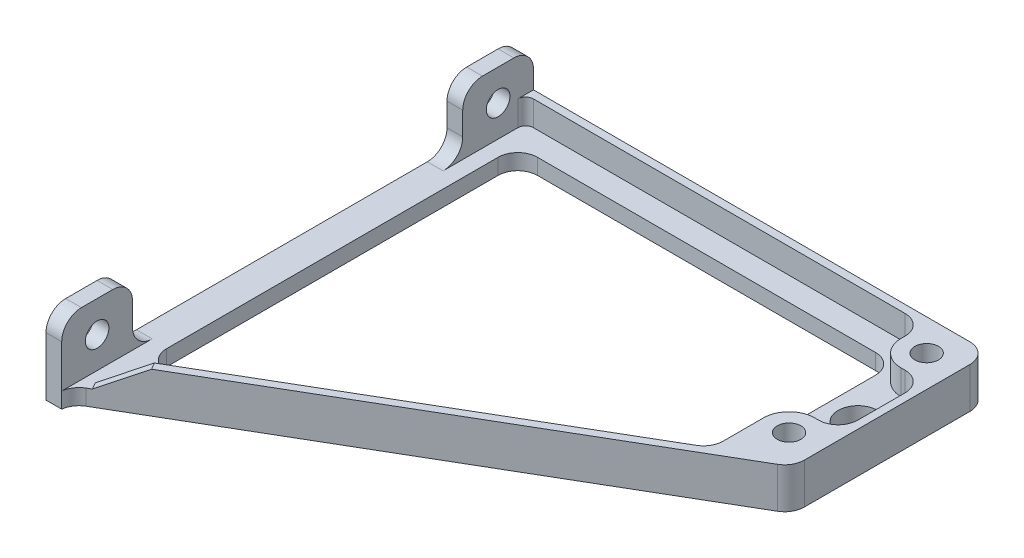
from build123d import *

# Parameters (mm, degrees)
BOSS_EXTRUDE1_DEPTH = 4
SKETCH2_R           = 3
CUT_EXTRUDE3_DEPTH  = 170.752761391
BOSS_EXTRUDE3_DEPTH = 6.35
CHAMFER1_SIZE       = 8.660254038
CHAMFER1_SIZE_2     = 15
BOSS_EXTRUDE4_START = 6.35
SKETCH8_R           = 3
BOSS_EXTRUDE4_DEPTH = 6.35
SKETCH9_W           = 4
SKETCH9_H           = 18
BOSS_EXTRUDE5_DEPTH = 15.875
SKETCH10_R          = 3
CUT_EXTRUDE4_DEPTH  = 110.875
FILLET3_R           = 5
SKETCH11_R          = 5
CUT_EXTRUDE5_DEPTH  = 15.875
FILLET4_R           = 2


with BuildPart() as part:
    # Sketch1 → Boss-Extrude1 (new body)
    with BuildSketch(Plane(origin=(0, 0, 0), x_dir=(1, 0, 0), z_dir=(0, 1, 0))):
        Polygon((0, 0), (120, 0), (120, -50), (4, -117.666666667), (4, -120), (0, -120), align=None)
    extrude(amount=BOSS_EXTRUDE1_DEPTH)

    # Sketch2 → Cut-Extrude3 (cut, through all)
    with BuildSketch(Plane(origin=(0, 4, 0), x_dir=(1, 0, 0), z_dir=(0, 1, 0))):
        with Locations(Location((112, -8, 0), (0, 0, 270))):
            Circle(SKETCH2_R)
        with Locations(Location((112, -43, 0), (0, 0, 270))):
            Circle(SKETCH2_R)
        Polygon((104, -8), (104, -50.071704007), (8, -106.071704007), (8, -8), align=None)
    extrude(amount=-CUT_EXTRUDE3_DEPTH, mode=Mode.SUBTRACT)

    # Sketch7 → Boss-Extrude3 (add)
    with BuildSketch(Plane(origin=(0, 4, 0), x_dir=(1, 0, 0), z_dir=(0, 1, 0))):
        Polygon((118, -48.851259335), (2.992257949, -115.939108865), (4, -117.666666667), (120, -50), (120, 0), (2.992257949, 0), (2.992257949, -2), (118, -2), align=None)
    extrude(amount=BOSS_EXTRUDE3_DEPTH)

    # Chamfer1
    # the kernel refuses this chamfer: 15, 8.660254038 mm, written as the material it takes off along each edge
    with BuildSketch(Plane(origin=(-16.561105336, 10.35, 82.41905752), x_dir=(0, -1, 0), z_dir=(0.5038710255240854, 0, 0.863778900898434))) as chamfer1_piece_1_section:
        Polygon((CHAMFER1_SIZE, 0), (0, CHAMFER1_SIZE_2), (0, 0), align=None)
    chamfer1_piece_1 = extrude(amount=79.612572639, mode=Mode.PRIVATE)
    chamfer1_piece_1 = split(chamfer1_piece_1, bisect_by=Plane(origin=(-16.561105336, 4, 82.41905752), z_dir=(0, 1, 0)), keep=Keep.TOP, mode=Mode.PRIVATE)
    add(chamfer1_piece_1, mode=Mode.SUBTRACT)

    # Sketch8 → Boss-Extrude4 (add)
    # profile 1 of 2: a face of its own
    with BuildSketch(Plane(origin=(0, 4, 0), x_dir=(1, 0, 0), z_dir=(0, 1, 0)).offset(BOSS_EXTRUDE4_START)):
        with BuildLine():
            Line((112, -14.5), (118, -14.5))
            Line((118, -14.5), (118, -2))
            Line((118, -2), (105.5, -2))
            Line((105.5, -2), (105.5, -8))
            ThreePointArc((105.5, -8), (107.403805922, -12.596194078), (112, -14.5))
        make_face()
        with Locations(Location((112, -8, 0), (0, 0, 270))):
            Circle(SKETCH8_R, mode=Mode.SUBTRACT)
    # profile 2 of 2: a face of its own
    with BuildSketch(Plane(origin=(0, 4, 0), x_dir=(1, 0, 0), z_dir=(0, 1, 0)).offset(BOSS_EXTRUDE4_START)):
        with BuildLine():
            Line((112, -36.5), (118, -36.5))
            Line((118, -36.5), (118, -48.851259335))
            Line((118, -48.851259335), (105.5, -56.142926002))
            Line((105.5, -56.142926002), (105.5, -43))
            ThreePointArc((105.5, -43), (107.403805922, -38.403805922), (112, -36.5))
        make_face()
        with Locations(Location((112, -43, 0), (0, 0, 270))):
            Circle(SKETCH8_R, mode=Mode.SUBTRACT)
    extrude(amount=-BOSS_EXTRUDE4_DEPTH)

    # Sketch9 → Boss-Extrude5 (add)
    with BuildSketch(Plane(origin=(0, 4, 0), x_dir=(1, 0, 0), z_dir=(0, 1, 0))):
        with Locations((2, -9)):
            Rectangle(SKETCH9_W, SKETCH9_H)
        with Locations((2, -111)):
            Rectangle(SKETCH9_W, SKETCH9_H)
    extrude(amount=BOSS_EXTRUDE5_DEPTH)

    # Sketch10 → Cut-Extrude4 (cut)
    with BuildSketch(Plane(origin=(4, 0, 0), x_dir=(0, 0, -1), z_dir=(1, 0, 0))):
        with Locations((-9, 11.9375)):
            Circle(SKETCH10_R)
        with Locations((-111, 11.9375)):
            Circle(SKETCH10_R)
    extrude(amount=-CUT_EXTRUDE4_DEPTH, mode=Mode.SUBTRACT)

    # Fillet3
    # the kernel refuses this fillet: 5 mm, written as the material it adds along each edge
    with BuildSketch(Plane(origin=(105.5, 10.35, 56.142926002), x_dir=(-0.863778900898437, 0, 0.50387102552408), z_dir=(0, -1, 0))) as fillet3_piece_1:
        with BuildLine():
            CenterArc((FILLET3_R * 0.574370332454, FILLET3_R), FILLET3_R, 210.256437164, 59.743562836)
            Line((-FILLET3_R * 0.289408568444, FILLET3_R * 0.496128974476), (0, 0))
            Line((0, 0), (FILLET3_R * 0.574370332454, 0))
        make_face()
    extrude(amount=6.35)
    with BuildSketch(Plane(origin=(118, 10.35, 36.5), x_dir=(-1, 0, 0), z_dir=(0, -1, 0))) as fillet3_piece_2:
        with BuildLine():
            CenterArc((FILLET3_R, FILLET3_R), FILLET3_R, 180, 90)
            Line((0, FILLET3_R), (0, 0))
            Line((0, 0), (FILLET3_R, 0))
        make_face()
    extrude(amount=6.35)
    with BuildSketch(Plane(origin=(118, 10.35, 14.5), x_dir=(-1, 0, 0), z_dir=(0, -1, 0)), Plane(origin=(105.5, 10.35, 2), x_dir=(-1, 0, 0), z_dir=(0, -1, 0))) as fillet3_piece_3:
        with BuildLine():
            CenterArc((FILLET3_R, -FILLET3_R), FILLET3_R, 90, 90)
            Line((0, -FILLET3_R), (0, 0))
            Line((0, 0), (FILLET3_R, 0))
        make_face()
    extrude(amount=6.35)
    with BuildSketch(Plane(origin=(4, 0, 117.666666667), x_dir=(0.863778900898435, 0, -0.5038710255240835), z_dir=(0, 1, 0))) as fillet3_piece_4:
        with BuildLine():
            CenterArc((2.835867325, -5), FILLET3_R, 90, 53.351575298)
            Line((-1.17569906, -2.015484102), (0, 0))
            Line((0, 0), (2.835867325, 0))
        make_face()
    extrude(amount=4)
    with BuildSketch(Plane(origin=(8, 4, 106.071704007), x_dir=(0.8637789008984339, 0, -0.5038710255240852), z_dir=(0, -1, 0))) as fillet3_piece_5:
        with BuildLine():
            CenterArc((FILLET3_R * 1.74103699912, -FILLET3_R), FILLET3_R, 90, 120.256437164)
            Line((FILLET3_R * 0.877258098222, -FILLET3_R * 1.50387102552), (0, 0))
            Line((0, 0), (FILLET3_R * 1.74103699912, 0))
        make_face()
    extrude(amount=4)
    with BuildSketch(Plane(origin=(104, 4, 50.071704007), x_dir=(-0.8637789008984337, 0, 0.5038710255240859), z_dir=(0, -1, 0))) as fillet3_piece_6:
        with BuildLine():
            CenterArc((FILLET3_R * 0.574370332454, FILLET3_R), FILLET3_R, 210.256437164, 59.743562836)
            Line((-FILLET3_R * 0.289408568444, FILLET3_R * 0.496128974476), (0, 0))
            Line((0, 0), (FILLET3_R * 0.574370332454, 0))
        make_face()
    extrude(amount=4)
    with BuildSketch(Plane(origin=(104, 4, 8), x_dir=(-1, 0, 0), z_dir=(0, -1, 0)), Plane(origin=(8, 4, 8), x_dir=(0, 0, 1), z_dir=(0, -1, 0))) as fillet3_piece_7:
        with BuildLine():
            CenterArc((FILLET3_R, -FILLET3_R), FILLET3_R, 90, 90)
            Line((0, -FILLET3_R), (0, 0))
            Line((0, 0), (FILLET3_R, 0))
        make_face()
    extrude(amount=4)
    with BuildSketch(Plane(origin=(4, 4, 102), x_dir=(0, 1, 0), z_dir=(-1, 0, 0)), Plane(origin=(4, 4, 18), x_dir=(0, 0, 1), z_dir=(-1, 0, 0))) as fillet3_piece_8:
        with BuildLine():
            CenterArc((FILLET3_R, FILLET3_R), FILLET3_R, 180, 90)
            Line((0, FILLET3_R), (0, 0))
            Line((0, 0), (FILLET3_R, 0))
        make_face()
    extrude(amount=4)
    # the kernel refuses this fillet: 5 mm, written as the material it takes off along each edge
    with BuildSketch(Plane(origin=(120, 22.85, 0), x_dir=(-1, 0, 0), z_dir=(0, -1, 0))) as fillet3_2_piece_1:
        with BuildLine():
            CenterArc((FILLET3_R, -FILLET3_R), FILLET3_R, 90, 90)
            Line((0, -FILLET3_R), (0, 0))
            Line((0, 0), (FILLET3_R, 0))
        make_face()
    extrude(amount=35.35, mode=Mode.SUBTRACT)
    with BuildSketch(Plane(origin=(120, 17.529629156, 50), x_dir=(0, 0, -1), z_dir=(0, -1, 0))) as fillet3_2_piece_2:
        with BuildLine():
            CenterArc((FILLET3_R * 0.574370332454, -FILLET3_R), FILLET3_R, 90, 59.743562836)
            Line((-FILLET3_R * 0.289408568444, -FILLET3_R * 0.496128974476), (0, 0))
            Line((0, 0), (FILLET3_R * 0.574370332454, 0))
        make_face()
    extrude(amount=24.709258311, mode=Mode.SUBTRACT)
    with BuildSketch(Plane(origin=(-12.5, 19.875, 120), x_dir=(0, 0, -1), z_dir=(1, 0, 0)), Plane(origin=(-12.5, 19.875, 0), x_dir=(0, -1, 0), z_dir=(1, 0, 0)), Plane(origin=(16.5, 19.875, 18), x_dir=(0, -1, 0), z_dir=(-1, 0, 0))) as fillet3_2_piece_3:
        with BuildLine():
            CenterArc((FILLET3_R, -FILLET3_R), FILLET3_R, 90, 90)
            Line((0, -FILLET3_R), (0, 0))
            Line((0, 0), (FILLET3_R, 0))
        make_face()
    extrude(amount=29, mode=Mode.SUBTRACT)
    with BuildSketch(Plane(origin=(16.5, 19.875, 102), x_dir=(0, -1, 0), z_dir=(-1, 0, 0))) as fillet3_2_piece_4:
        with BuildLine():
            CenterArc((FILLET3_R, FILLET3_R), FILLET3_R, 180, 90)
            Line((0, FILLET3_R), (0, 0))
            Line((0, 0), (FILLET3_R, 0))
        make_face()
    extrude(amount=29, mode=Mode.SUBTRACT)

    # Sketch11 → Cut-Extrude5 (cut)
    with BuildSketch(Plane(origin=(0, 4, 0), x_dir=(1, 0, 0), z_dir=(0, 1, 0))):
        with Locations(Location((112, -25.5, 0), (0, 0, 270))):
            Circle(SKETCH11_R)
    extrude(amount=-CUT_EXTRUDE5_DEPTH, mode=Mode.SUBTRACT)

    # Fillet4
    fillet4_edges = [part.edges().sort_by_distance(p)[0] for p in [
        (4, 7.175, 2),
    ]]
    fillet(fillet4_edges, radius=FILLET4_R)


solid = part.part
